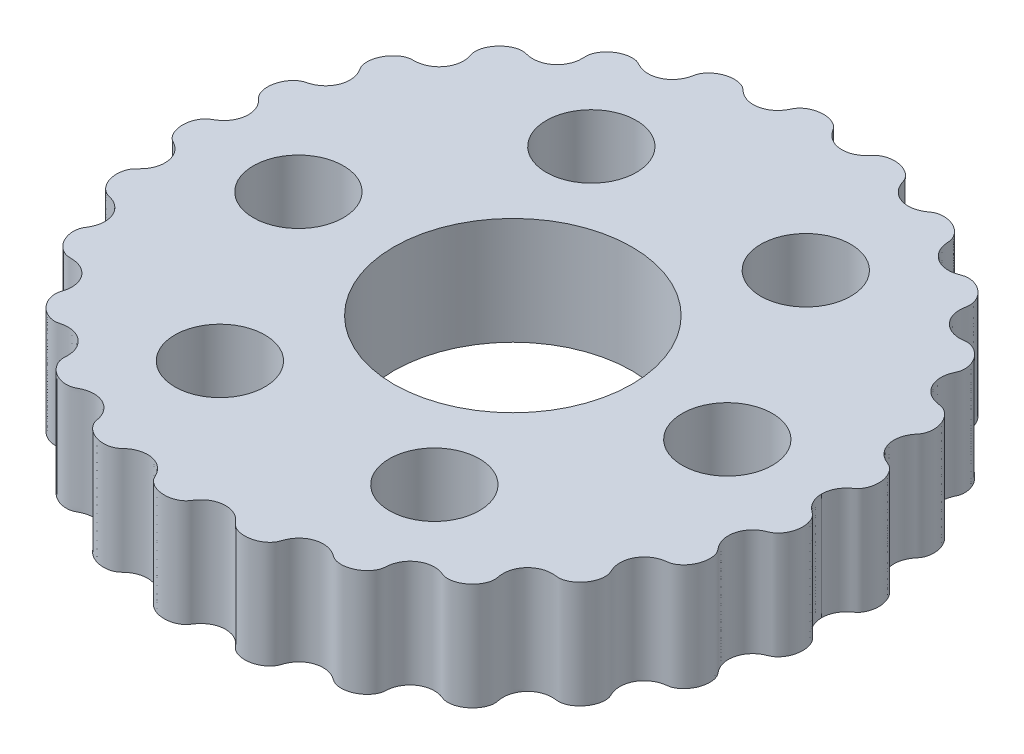
from build123d import *

# Parameters (mm, degrees)
BOSS_EXTRUDE1_DEPTH = 5
SKETCH3_R           = 2.1
CUT_EXTRUDE1_DEPTH  = 23.326267348
SKETCH5_R           = 5.55
CUT_EXTRUDE2_DEPTH  = 23.326267348


with BuildPart() as part:
    # Sketch2 → Boss-Extrude1 (new body)
    with BuildSketch(Plane(origin=(0, 0, 0), x_dir=(1, 0, 0), z_dir=(0, 1, 0))):
        with BuildLine():
            add(Edge.make_bspline(
                [(14.4, -2.48e-07), (14.4, -0.017964131), (14.400999323, -0.054156008), (14.405496279, -0.12324579), (14.417452588, -0.205733979), (14.435300772, -0.284761116), (14.45893618, -0.363830072), (14.495530695, -0.46010355), (14.553831721, -0.577672937), (14.628963244, -0.690475456), (14.720523686, -0.795156479), (14.809877886, -0.878529951), (14.885972343, -0.939710566), (14.965266253, -0.996877467), (15.039390274, -1.060755974), (15.101813025, -1.136527175), (15.154322573, -1.219306863), (15.208602362, -1.329233091), (15.256294433, -1.468797492), (15.288096968, -1.638084003), (15.294503312, -1.881018198), (15.252297927, -2.119868214), (15.163760046, -2.344380457), (15.042398399, -2.523140326), (14.942454238, -2.628650823), (14.84531186, -2.703604014), (14.757199304, -2.750371405), (14.664408479, -2.786732589), (14.573413051, -2.826966073), (14.463621811, -2.885730431), (14.30896843, -2.99023977), (14.130503739, -3.165844964), (13.97214753, -3.43499314), (13.893985611, -3.773342211), (13.916927587, -4.080339103), (13.995171076, -4.31020064), (14.08241223, -4.468542212), (14.150259365, -4.567703904), (14.210025718, -4.642870515), (14.270573552, -4.717649373), (14.320176209, -4.800200779), (14.365416677, -4.910919215), (14.399338348, -5.049561823), (14.416852099, -5.26239869), (14.384339959, -5.500937731), (14.304055891, -5.731023632), (14.177985992, -5.941781926), (14.047854196, -6.09573186), (13.910788986, -6.208565852), (13.777136588, -6.284416414), (13.654566215, -6.325933937), (13.550559771, -6.34133553), (13.446683486, -6.355615469), (13.344145731, -6.378219503), (13.218558644, -6.416412813), (13.049117811, -6.490187976), (12.850381057, -6.623877128), (12.649361495, -6.848376812), (12.506075198, -7.152262136), (12.462998251, -7.451003127), (12.489971746, -7.692058544), (12.539204468, -7.862350677), (12.58028645, -7.968000593), (12.618269622, -8.05035295), (12.654435266, -8.133644712), (12.678283575, -8.221362625), (12.692937759, -8.335981179), (12.690655472, -8.476153448), (12.654302956, -8.685493534), (12.545223608, -8.951239132), (12.373056799, -9.183722876), (12.149188229, -9.366304736), (11.953263909, -9.463318322), (11.811585985, -9.506241427), (11.686731299, -9.522483952), (11.583488414, -9.516968845), (11.481158005, -9.503432911), (11.378198356, -9.496859163), (11.27492891, -9.498212556), (11.172138152, -9.508022579), (11.00848965, -9.53818977), (10.791017774, -9.615836424), (10.543764649, -9.778692295), (10.347433573, -10.024278355), (10.24020892, -10.268607422), (10.194325427, -10.484243678), (10.185347382, -10.638429728), (10.193136342, -10.770510313), (10.209145906, -10.879533536), (10.225592928, -10.966240334), (10.235972153, -11.053921901), (10.233096033, -11.142311619), (10.215768495, -11.253426268), (10.176715504, -11.384209786), (10.088556978, -11.571773091), (9.914554743, -11.800570757), (9.643928691, -12.015790427), (9.338393465, -12.131431598), (9.092328038, -12.151919652), (8.938831082, -12.124722439), (8.874147562, -12.10491764), (8.823296452, -12.08626675), (8.760021443, -12.062210467), (8.657742174, -12.026792627), (8.51270826, -11.991319701), (8.295427931, -11.971044702), (8.023341789, -12.005783546), (7.739745144, -12.120021341), (7.477485771, -12.330308645), (7.309270878, -12.575786103), (7.227745229, -12.796401843), (7.194847234, -12.964652252), (7.183072937, -13.072922936), (7.177409691, -13.159952141), (7.163855658, -13.268191686), (7.120743744, -13.396146509), (7.043211227, -13.53573222), (6.896275027, -13.715388699), (6.667817372, -13.896296354), (6.347778495, -14.038713244), (6.019984619, -14.072733936), (5.761854657, -14.026889945), (5.598537574, -13.9438235), (5.512636, -13.880075243), (5.401772721, -13.805681202), (5.259871252, -13.730304377), (5.052430943, -13.656485505), (4.773826567, -13.622953403), (4.462558539, -13.668320481), (4.188838479, -13.799904328), (3.991154483, -13.966548105), (3.85783339, -14.133925722), (3.78259476, -14.263163115), (3.730894761, -14.379946807), (3.695922871, -14.480037823), (3.668902786, -14.560560916), (3.625075946, -14.65731075), (3.549395473, -14.764707093), (3.439982071, -14.875186556), (3.255657122, -15.006023014), (2.992826186, -15.12014402), (2.651468448, -15.175703585), (2.340640026, -15.129056213), (2.125824212, -15.033765178), (2.01095168, -14.946774732), (1.969758957, -14.909017393), (1.931738615, -14.868052651), (1.895415502, -14.825543114), (1.849862653, -14.772584168), (1.773475414, -14.691023973), (1.657606841, -14.589329712), (1.467715812, -14.468702272), (1.201269864, -14.374829544), (0.894275687, -14.35178124), (0.570472276, -14.423576672), (0.317305019, -14.563244131), (0.151543737, -14.714094099), (0.048134733, -14.841768382), (-0.011408, -14.928872831), (-0.056991615, -15.000049359), (-0.120513991, -15.084516969), (-0.216681119, -15.171117243), (-0.345492256, -15.252082149), (-0.548378411, -15.335584257), (-0.812768968, -15.385412436), (-1.083981162, -15.372591), (-1.344980225, -15.297228229), (-1.543454077, -15.192187965), (-1.665765334, -15.097631249), (-1.754670924, -15.002004579), (-1.811225099, -14.912765423), (-1.848285474, -14.836852784), (-1.894840642, -14.742230285), (-1.981133414, -14.596440624), (-2.130461975, -14.41529174), (-2.371748068, -14.237402882), (-2.694147074, -14.12430371), (-3.005808219, -14.112082243), (-3.27980323, -14.174237527), (-3.481366461, -14.271328267), (-3.607738638, -14.35811219), (-3.692851155, -14.429557516), (-3.744274314, -14.476276993), (-3.785484942, -14.513602659), (-3.839037634, -14.557815957), (-3.971848421, -14.642560884), (-4.209212537, -14.71633601), (-4.537870574, -14.723205644), (-4.870973603, -14.623309475), (-5.119165063, -14.474113271), (-5.287203238, -14.31612745), (-5.381819707, -14.188748958), (-5.441587137, -14.06862443), (-5.469754906, -13.963936343), (-5.486205657, -13.878818164), (-5.510616073, -13.773375732), (-5.562786354, -13.611201417), (-5.668640559, -13.402850243), (-5.861502161, -13.180790139), (-6.140858341, -13.003604858), (-6.432389467, -12.920478649), (-6.707047509, -12.913935003), (-6.924587844, -12.957968071), (-7.070503085, -13.011926038), (-7.171893159, -13.06122639), (-7.234172994, -13.094293424), (-7.284238774, -13.120335774), (-7.348454987, -13.149382122), (-7.450393388, -13.181304909), (-7.592860605, -13.199324175), (-7.822504876, -13.18751304), (-8.108179682, -13.101881323), (-8.360700489, -12.948081014), (-8.564055044, -12.739256852), (-8.686860825, -12.541024859), (-8.745859512, -12.39133299), (-8.771139873, -12.257944389), (-8.769724063, -12.14815779), (-8.764489294, -12.060598983), (-8.763284318, -11.951024196), (-8.773134952, -11.821211292), (-8.801859902, -11.673188778), (-8.872938117, -11.471739551), (-9.004528991, -11.249997896), (-9.220498673, -11.035105879), (-9.499738451, -10.890461106), (-9.747534163, -10.836884111), (-9.938296626, -10.832212303), (-10.067515746, -10.843723353), (-10.16983799, -10.860856705), (-10.270401867, -10.885914711), (-10.371725416, -10.908894526), (-10.499541343, -10.914402223), (-10.649899927, -10.893031168), (-10.864422553, -10.823594557), (-11.115447437, -10.67017858), (-11.318488792, -10.460804265), (-11.461427127, -10.21187442), (-11.524753371, -10.013390682), (-11.546392318, -9.877676724), (-11.548710475, -9.764592888), (-11.539340488, -9.676133867), (-11.51689895, -9.590205974), (-11.489593691, -9.505763504), (-11.460576992, -9.398790066), (-11.437116489, -9.267754038), (-11.428039041, -9.112623117), (-11.448899856, -8.891731429), (-11.525306922, -8.644377974), (-11.680560347, -8.391693336), (-11.908335499, -8.189291512), (-12.146090041, -8.066430785), (-12.351541248, -8.011177394), (-12.509041632, -7.991838642), (-12.640827037, -7.989459677), (-12.746564356, -7.988165361), (-12.874376095, -7.963827043), (-13.017764848, -7.905878909), (-13.169249477, -7.811410927), (-13.319018326, -7.674673565), (-13.471981971, -7.48051382), (-13.581459114, -7.260882561), (-13.64401371, -7.026574245), (-13.652861352, -6.812938875), (-13.63653963, -6.672849265), (-13.606445966, -6.560513177), (-13.570431599, -6.476445112), (-13.523166392, -6.398236645), (-13.47516984, -6.320636942), (-13.42152346, -6.219947813), (-13.352206861, -6.05560861), (-13.297223541, -5.817804655), (-13.306144326, -5.511230794), (-13.418271159, -5.185791445), (-13.599551019, -4.937284586), (-13.788421992, -4.782569597), (-13.950444631, -4.693121576), (-14.068010882, -4.644080471), (-14.164678518, -4.61208046), (-14.263359035, -4.586967358), (-14.36062291, -4.556202679), (-14.4720648, -4.497212289), (-14.590575081, -4.405386747), (-14.741515897, -4.240875697), (-14.885567969, -3.984038862), (-14.960547494, -3.700012411), (-14.962477183, -3.409355837), (-14.917122765, -3.199363963), (-14.864866345, -3.06554937), (-14.80476262, -2.961266815), (-14.743749732, -2.885984676), (-14.673498739, -2.81936508), (-14.60476009, -2.751453058), (-14.541077611, -2.678634146), (-14.482882478, -2.601335407), (-14.398435183, -2.468447561), (-14.309916031, -2.267780594), (-14.25723967, -1.991629089), (-14.294765542, -1.652710045), (-14.415656703, -1.372496047), (-14.564768549, -1.180601379), (-14.700945739, -1.058516228), (-14.801501711, -0.985659956), (-14.885953488, -0.933564713), (-14.973240538, -0.886145701), (-15.055953201, -0.830914272), (-15.145346025, -0.745701448), (-15.234104596, -0.62787553), (-15.302099659, -0.497915803), (-15.350570884, -0.359468333), (-15.378415718, -0.242179397), (-15.393222637, -0.147286992), (-15.398767777, -0.063517745), (-15.4, -0.021212182), (-15.4, 1.28e-07)],
                knots=[0.062565796, 0.062565796, 0.062565796, 0.062565796, 0.062565796, 0.063859973, 0.06515415, 0.066448326, 0.067742503, 0.06903668, 0.070330857, 0.07291921, 0.075992333, 0.077528894, 0.079065456, 0.080602017, 0.082138578, 0.08367514, 0.085211701, 0.086753761, 0.088295822, 0.091379943, 0.094464064, 0.097548185, 0.103528845, 0.106519174, 0.109509504, 0.111075374, 0.112641243, 0.114207112, 0.115772981, 0.117338851, 0.11890472, 0.122036458, 0.127492162, 0.132947866, 0.138255082, 0.143562297, 0.146585003, 0.148096356, 0.149607709, 0.151119061, 0.152630414, 0.154141767, 0.15565312, 0.158617995, 0.161582869, 0.167512619, 0.170668106, 0.173823593, 0.17697908, 0.180134567, 0.181785014, 0.183435461, 0.185085908, 0.186736355, 0.188386802, 0.190037249, 0.193338142, 0.198333612, 0.203329082, 0.208757311, 0.21418554, 0.217038738, 0.218465337, 0.219891935, 0.221318534, 0.222745133, 0.224171732, 0.225598331, 0.22856804, 0.23153775, 0.237477169, 0.243508984, 0.246524892, 0.2495408, 0.251163787, 0.252786774, 0.254409762, 0.256032749, 0.257655736, 0.259278723, 0.26090171, 0.262524697, 0.268116353, 0.273708009, 0.279232337, 0.2819945, 0.284756664, 0.287531357, 0.288918704, 0.290306051, 0.291693397, 0.293080744, 0.294468091, 0.295855437, 0.298751953, 0.301648468, 0.307441499, 0.313806246, 0.320170993, 0.321874543, 0.322726318, 0.323578093, 0.324429868, 0.325281643, 0.326985192, 0.330392292, 0.333799391, 0.338941908, 0.344084424, 0.349371027, 0.354657629, 0.357399899, 0.358771034, 0.360142168, 0.361513303, 0.362884438, 0.365626708, 0.368571539, 0.37151637, 0.377406032, 0.383827609, 0.390249186, 0.391929851, 0.393610516, 0.39529118, 0.396971845, 0.400333174, 0.403694503, 0.409075747, 0.41445699, 0.419832854, 0.422520785, 0.425208717, 0.427878342, 0.429213155, 0.430547968, 0.431882781, 0.433217593, 0.435887219, 0.438758038, 0.441628857, 0.447370496, 0.453780785, 0.460191075, 0.461070296, 0.461949517, 0.462828738, 0.463707959, 0.46458718, 0.465466401, 0.467224842, 0.470741726, 0.47425861, 0.479541903, 0.484825197, 0.489835983, 0.494846769, 0.497503724, 0.498832202, 0.500160679, 0.501489157, 0.502817634, 0.505474589, 0.508247059, 0.511019529, 0.516564468, 0.52227034, 0.525123276, 0.527976212, 0.530631288, 0.531958826, 0.533286364, 0.534613902, 0.53594144, 0.538596516, 0.543936045, 0.549275574, 0.554531257, 0.559786941, 0.563284399, 0.566781857, 0.568530587, 0.569404951, 0.570279316, 0.57115368, 0.572028045, 0.573776774, 0.580152949, 0.586529123, 0.592383377, 0.595310504, 0.598237631, 0.600962992, 0.602325673, 0.603688354, 0.605051034, 0.606413715, 0.609139076, 0.614392618, 0.619646159, 0.624660447, 0.629674735, 0.633223523, 0.636772312, 0.638546707, 0.639433904, 0.640321101, 0.641208298, 0.642095495, 0.64386989, 0.647025799, 0.650181709, 0.656493529, 0.662419511, 0.665382503, 0.668345494, 0.671104535, 0.672484055, 0.673863575, 0.675243096, 0.676622616, 0.679381657, 0.682041398, 0.68470114, 0.690020622, 0.695473381, 0.700926139, 0.704188253, 0.70581931, 0.707450368, 0.709081425, 0.710712482, 0.712343539, 0.713974596, 0.717095441, 0.720216286, 0.726457975, 0.732286917, 0.735201388, 0.738115858, 0.739511278, 0.740906697, 0.742302116, 0.743697535, 0.745092954, 0.746488373, 0.749279211, 0.752059022, 0.754838832, 0.760398454, 0.765423781, 0.770449108, 0.773768675, 0.777088241, 0.778748025, 0.780407808, 0.782067591, 0.783727374, 0.786901153, 0.790074931, 0.793248709, 0.796422487, 0.802397424, 0.805384893, 0.808372361, 0.809807963, 0.811243566, 0.812679168, 0.81411477, 0.815550372, 0.816985974, 0.819857178, 0.825317904, 0.830778629, 0.835989797, 0.841200965, 0.844404173, 0.846005778, 0.847607382, 0.849208986, 0.85081059, 0.852412194, 0.854013798, 0.857107086, 0.860200373, 0.866386948, 0.872352981, 0.875335998, 0.878319014, 0.879839881, 0.881360748, 0.882881615, 0.884402482, 0.885923349, 0.887444216, 0.888965083, 0.890485949, 0.895823145, 0.90116034, 0.906397405, 0.911634469, 0.914757263, 0.91631866, 0.917880057, 0.919441454, 0.921002851, 0.922564248, 0.924125645, 0.927182053, 0.930238461, 0.931766665, 0.933294869, 0.934823073, 0.936351277, 0.936351277, 0.936351277, 0.936351277, 0.936351277], degree=4))
            add(Edge.make_bspline(
                [(14.4, -2.48e-07), (14.4, 0.017963643), (14.400999324, 0.05415552), (14.405496282, 0.123245302), (14.417452594, 0.20573349), (14.435300779, 0.284760627), (14.458936189, 0.363829582), (14.495530706, 0.46010306), (14.553831735, 0.577672445), (14.628963261, 0.690474962), (14.720523706, 0.795155983), (14.809877908, 0.878529452), (14.885972367, 0.939710066), (14.965266278, 0.996876964), (15.039390301, 1.06075547), (15.101813054, 1.13652667), (15.154322603, 1.219306356), (15.208602395, 1.329232582), (15.25629447, 1.468796983), (15.288097009, 1.638083493), (15.294503359, 1.881017687), (15.25229798, 2.119867705), (15.163760104, 2.34437995), (15.042398462, 2.523139822), (14.942454304, 2.628650321), (14.845311928, 2.703603515), (14.757199373, 2.750370908), (14.664408549, 2.786732094), (14.573413122, 2.82696558), (14.463621883, 2.885729941), (14.308968504, 2.990239283), (14.130503818, 3.165844482), (13.972147616, 3.434992663), (13.893985705, 3.773341735), (13.916927688, 4.080338626), (13.995171183, 4.310200161), (14.082412341, 4.468541732), (14.150259479, 4.567703422), (14.210025833, 4.642870031), (14.270573669, 4.717648888), (14.320176329, 4.800200293), (14.3654168, 4.910918728), (14.399338473, 5.049561335), (14.41685223, 5.262398201), (14.384340096, 5.500937243), (14.304056034, 5.731023146), (14.17798614, 5.941781443), (14.047854348, 6.09573138), (13.91078914, 6.208565376), (13.777136745, 6.284415941), (13.654566372, 6.325933467), (13.550559929, 6.341335063), (13.446683645, 6.355615004), (13.34414589, 6.378219041), (13.218558803, 6.416412354), (13.049117972, 6.490187522), (12.850381222, 6.623876678), (12.649361665, 6.848376367), (12.506075376, 7.152261695), (12.462998437, 7.451002686), (12.489971937, 7.692058103), (12.539204664, 7.862350235), (12.580286648, 7.96800015), (12.618269822, 8.050352506), (12.654435469, 8.133644267), (12.67828378, 8.22136218), (12.692937966, 8.335980733), (12.690655683, 8.476153002), (12.654303173, 8.685493089), (12.545223831, 8.95123869), (12.373057028, 9.183722438), (12.149188462, 9.366304303), (11.953264144, 9.463317894), (11.811586222, 9.506241003), (11.686731537, 9.522483531), (11.583488651, 9.516968426), (11.481158241, 9.503432495), (11.378198593, 9.49685875), (11.274929146, 9.498212146), (11.172138389, 9.508022171), (11.008489887, 9.538189366), (10.791018013, 9.615836025), (10.543764892, 9.778691902), (10.347433822, 10.024277967), (10.240209176, 10.268607037), (10.194325688, 10.484243294), (10.185347647, 10.638429345), (10.19313661, 10.770509929), (10.209146177, 10.879533152), (10.225593201, 10.966239949), (10.235972428, 11.053921516), (10.23309631, 11.142311234), (10.215768775, 11.253425883), (10.176715788, 11.384209403), (10.088557266, 11.57177271), (9.914555037, 11.80057038), (9.64392899, 12.015790057), (9.338393767, 12.131431236), (9.092328341, 12.151919296), (8.938831384, 12.124722086), (8.874147863, 12.104917289), (8.823296753, 12.0862664), (8.760021743, 12.062210119), (8.657742474, 12.026792282), (8.512708559, 11.991319359), (8.295428229, 11.971044365), (8.023342088, 12.005783216), (7.739745446, 12.120021019), (7.477486078, 12.330308329), (7.309271191, 12.575785792), (7.227745548, 12.796401533), (7.194847557, 12.964651943), (7.183073263, 13.072922627), (7.177410019, 13.159951833), (7.163855988, 13.268191378), (7.120744078, 13.396146202), (7.043211564, 13.535731915), (6.896275369, 13.715388397), (6.667817718, 13.896296058), (6.347778845, 14.038712956), (6.019984969, 14.072733656), (5.761855006, 14.026889672), (5.598537921, 13.943823231), (5.512636345, 13.880074976), (5.401773065, 13.805680938), (5.259871594, 13.730304116), (5.052431284, 13.65648525), (4.773826906, 13.622953154), (4.462558879, 13.66832024), (4.188838823, 13.799904094), (3.991154831, 13.966547876), (3.857833742, 14.133925496), (3.782595116, 14.263162891), (3.730895119, 14.379946584), (3.695923232, 14.480037601), (3.668903149, 14.560560695), (3.625076311, 14.65731053), (3.549395841, 14.764706874), (3.439982442, 14.87518634), (3.255657496, 15.006022803), (2.992826562, 15.120143816), (2.651468826, 15.175703389), (2.340640403, 15.129056025), (2.125824586, 15.033764995), (2.010952052, 14.946774553), (1.969759328, 14.909017214), (1.931738985, 14.868052473), (1.895415871, 14.825542937), (1.849863021, 14.772583992), (1.77347578, 14.691023799), (1.657607204, 14.589329541), (1.467716173, 14.468702105), (1.201270222, 14.374829384), (0.894276044, 14.351781087), (0.570472635, 14.423576528), (0.317305382, 14.563243994), (0.151544104, 14.714093965), (0.048135102, 14.841768251), (-0.011407628, 14.928872701), (-0.056991241, 15.000049231), (-0.120513615, 15.084516842), (-0.216680741, 15.171117118), (-0.345491876, 15.252082028), (-0.548378029, 15.33558414), (-0.812768585, 15.385412326), (-1.08398078, 15.372590897), (-1.344979844, 15.297228132), (-1.543453699, 15.192187873), (-1.665764958, 15.097631161), (-1.75467055, 15.002004493), (-1.811224727, 14.912765339), (-1.848285105, 14.8368527), (-1.894840274, 14.742230203), (-1.981133051, 14.596440543), (-2.130461616, 14.415291664), (-2.371747714, 14.237402812), (-2.694146722, 14.124303648), (-3.005807868, 14.112082188), (-3.279802877, 14.174237479), (-3.481366106, 14.271328224), (-3.607738281, 14.35811215), (-3.692850795, 14.429557478), (-3.744273954, 14.476276956), (-3.785484581, 14.513602624), (-3.839037271, 14.557815923), (-3.971848056, 14.642560853), (-4.20921217, 14.716335985), (-4.537870208, 14.723205627), (-4.870973239, 14.623309466), (-5.119164702, 14.474113269), (-5.287202882, 14.316127452), (-5.381819354, 14.188748962), (-5.441586787, 14.068624436), (-5.469754558, 13.96393635), (-5.486205311, 13.878818171), (-5.51061573, 13.77337574), (-5.562786015, 13.611201426), (-5.668640225, 13.402850255), (-5.861501833, 13.180790155), (-6.140858017, 13.003604881), (-6.432389146, 12.92047868), (-6.707047187, 12.91393504), (-6.924587522, 12.957968114), (-7.070502761, 13.011926084), (-7.171892834, 13.061226439), (-7.234172667, 13.094293474), (-7.284238447, 13.120335826), (-7.34845466, 13.149382175), (-7.45039306, 13.181304965), (-7.592860276, 13.199324234), (-7.822504547, 13.187513105), (-8.108179356, 13.101881395), (-8.360700166, 12.948081092), (-8.564054727, 12.739256935), (-8.686860513, 12.541024946), (-8.745859203, 12.391333078), (-8.771139568, 12.257944478), (-8.76972376, 12.148157879), (-8.764488993, 12.060599072), (-8.76328402, 11.951024284), (-8.773134658, 11.821211381), (-8.801859611, 11.673188867), (-8.872937831, 11.471739642), (-9.004528711, 11.249997991), (-9.220498398, 11.035105979), (-9.49973818, 10.890461213), (-9.747533893, 10.836884224), (-9.938296357, 10.832212421), (-10.067515476, 10.843723474), (-10.16983772, 10.860856829), (-10.270401596, 10.885914837), (-10.371725144, 10.908894655), (-10.499541071, 10.914402354), (-10.649899655, 10.893031304), (-10.864422283, 10.823594698), (-11.115447172, 10.670178727), (-11.318488531, 10.460804417), (-11.461426873, 10.211874576), (-11.524753121, 10.01339084), (-11.546392072, 9.877676882), (-11.548710232, 9.764593046), (-11.539340247, 9.676134025), (-11.516898711, 9.590206131), (-11.489593455, 9.50576366), (-11.460576758, 9.398790222), (-11.437116258, 9.267754193), (-11.428038814, 9.112623272), (-11.448899634, 8.891731584), (-11.525306707, 8.644378131), (-11.680560138, 8.391693497), (-11.908335295, 8.189291679), (-12.14608984, 8.066430957), (-12.351541049, 8.011177571), (-12.509041433, 7.991838824), (-12.640826838, 7.989459862), (-12.746564157, 7.988165548), (-12.874375897, 7.963827234), (-13.017764651, 7.905879104), (-13.169249283, 7.811411125), (-13.319018135, 7.674673767), (-13.471981785, 7.480514026), (-13.581458933, 7.260882769), (-13.644013535, 7.026574455), (-13.652861182, 6.812939085), (-13.636539464, 6.672849475), (-13.606445803, 6.560513387), (-13.570431438, 6.47644532), (-13.523166232, 6.398236852), (-13.475169683, 6.320637148), (-13.421523305, 6.219948018), (-13.35220671, 6.055608813), (-13.297223396, 5.817804857), (-13.306144189, 5.511230995), (-13.41827103, 5.18579165), (-13.599550896, 4.937284795), (-13.788421873, 4.78256981), (-13.950444514, 4.693121794), (-14.068010766, 4.644080692), (-14.164678403, 4.612080683), (-14.263358921, 4.586967583), (-14.360622796, 4.556202907), (-14.472064688, 4.497212519), (-14.590574971, 4.40538698), (-14.741515792, 4.240875934), (-14.88556787, 3.984039103), (-14.960547402, 3.700012654), (-14.962477098, 3.40935608), (-14.917122685, 3.199364204), (-14.864866268, 3.065549611), (-14.804762546, 2.961267054), (-14.74374966, 2.885984913), (-14.673498669, 2.819365316), (-14.604760021, 2.751453291), (-14.541077544, 2.678634379), (-14.482882413, 2.601335638), (-14.398435122, 2.46844779), (-14.309915974, 2.267780821), (-14.25723962, 1.991629314), (-14.294765501, 1.652710271), (-14.415656668, 1.372496276), (-14.564768519, 1.180601612), (-14.700945713, 1.058516465), (-14.801501687, 0.985660195), (-14.885953465, 0.933564954), (-14.973240516, 0.886145944), (-15.05595318, 0.830914518), (-15.145346006, 0.745701695), (-15.234104581, 0.62787578), (-15.302099646, 0.497916054), (-15.350570875, 0.359468585), (-15.378415712, 0.24217965), (-15.393222633, 0.147287246), (-15.398767776, 0.063517999), (-15.4, 0.021212436), (-15.4, 1.28e-07)],
                knots=[0.062565796, 0.062565796, 0.062565796, 0.062565796, 0.062565796, 0.063859973, 0.06515415, 0.066448326, 0.067742503, 0.06903668, 0.070330857, 0.07291921, 0.075992333, 0.077528894, 0.079065456, 0.080602017, 0.082138578, 0.08367514, 0.085211701, 0.086753761, 0.088295822, 0.091379943, 0.094464064, 0.097548185, 0.103528845, 0.106519174, 0.109509504, 0.111075374, 0.112641243, 0.114207112, 0.115772981, 0.117338851, 0.11890472, 0.122036458, 0.127492162, 0.132947866, 0.138255082, 0.143562297, 0.146585003, 0.148096356, 0.149607709, 0.151119061, 0.152630414, 0.154141767, 0.15565312, 0.158617995, 0.161582869, 0.167512619, 0.170668106, 0.173823593, 0.17697908, 0.180134567, 0.181785014, 0.183435461, 0.185085908, 0.186736355, 0.188386802, 0.190037249, 0.193338142, 0.198333612, 0.203329082, 0.208757311, 0.21418554, 0.217038738, 0.218465337, 0.219891935, 0.221318534, 0.222745133, 0.224171732, 0.225598331, 0.22856804, 0.23153775, 0.237477169, 0.243508984, 0.246524892, 0.2495408, 0.251163787, 0.252786774, 0.254409762, 0.256032749, 0.257655736, 0.259278723, 0.26090171, 0.262524697, 0.268116353, 0.273708009, 0.279232337, 0.2819945, 0.284756664, 0.287531357, 0.288918704, 0.290306051, 0.291693397, 0.293080744, 0.294468091, 0.295855437, 0.298751953, 0.301648468, 0.307441499, 0.313806246, 0.320170993, 0.321874543, 0.322726318, 0.323578093, 0.324429868, 0.325281643, 0.326985192, 0.330392292, 0.333799391, 0.338941908, 0.344084424, 0.349371027, 0.354657629, 0.357399899, 0.358771034, 0.360142168, 0.361513303, 0.362884438, 0.365626708, 0.368571539, 0.37151637, 0.377406032, 0.383827609, 0.390249186, 0.391929851, 0.393610516, 0.39529118, 0.396971845, 0.400333174, 0.403694503, 0.409075747, 0.41445699, 0.419832854, 0.422520785, 0.425208717, 0.427878342, 0.429213155, 0.430547968, 0.431882781, 0.433217593, 0.435887219, 0.438758038, 0.441628857, 0.447370496, 0.453780785, 0.460191075, 0.461070296, 0.461949517, 0.462828738, 0.463707959, 0.46458718, 0.465466401, 0.467224842, 0.470741726, 0.47425861, 0.479541903, 0.484825197, 0.489835983, 0.494846769, 0.497503724, 0.498832202, 0.500160679, 0.501489157, 0.502817634, 0.505474589, 0.508247059, 0.511019529, 0.516564468, 0.52227034, 0.525123276, 0.527976212, 0.530631288, 0.531958826, 0.533286364, 0.534613902, 0.53594144, 0.538596516, 0.543936045, 0.549275574, 0.554531257, 0.559786941, 0.563284399, 0.566781857, 0.568530587, 0.569404951, 0.570279316, 0.57115368, 0.572028045, 0.573776774, 0.580152949, 0.586529123, 0.592383377, 0.595310504, 0.598237631, 0.600962992, 0.602325673, 0.603688354, 0.605051034, 0.606413715, 0.609139076, 0.614392618, 0.619646159, 0.624660447, 0.629674735, 0.633223523, 0.636772312, 0.638546707, 0.639433904, 0.640321101, 0.641208298, 0.642095495, 0.64386989, 0.647025799, 0.650181709, 0.656493529, 0.662419511, 0.665382503, 0.668345494, 0.671104535, 0.672484055, 0.673863575, 0.675243096, 0.676622616, 0.679381657, 0.682041398, 0.68470114, 0.690020622, 0.695473381, 0.700926139, 0.704188253, 0.70581931, 0.707450368, 0.709081425, 0.710712482, 0.712343539, 0.713974596, 0.717095441, 0.720216286, 0.726457975, 0.732286917, 0.735201388, 0.738115858, 0.739511278, 0.740906697, 0.742302116, 0.743697535, 0.745092954, 0.746488373, 0.749279211, 0.752059022, 0.754838832, 0.760398454, 0.765423781, 0.770449108, 0.773768675, 0.777088241, 0.778748025, 0.780407808, 0.782067591, 0.783727374, 0.786901153, 0.790074931, 0.793248709, 0.796422487, 0.802397424, 0.805384893, 0.808372361, 0.809807963, 0.811243566, 0.812679168, 0.81411477, 0.815550372, 0.816985974, 0.819857178, 0.825317904, 0.830778629, 0.835989797, 0.841200965, 0.844404173, 0.846005778, 0.847607382, 0.849208986, 0.85081059, 0.852412194, 0.854013798, 0.857107086, 0.860200373, 0.866386948, 0.872352981, 0.875335998, 0.878319014, 0.879839881, 0.881360748, 0.882881615, 0.884402482, 0.885923349, 0.887444216, 0.888965083, 0.890485949, 0.895823145, 0.90116034, 0.906397405, 0.911634469, 0.914757263, 0.91631866, 0.917880057, 0.919441454, 0.921002851, 0.922564248, 0.924125645, 0.927182053, 0.930238461, 0.931766665, 0.933294869, 0.934823073, 0.936351277, 0.936351277, 0.936351277, 0.936351277, 0.936351277], degree=4))
        make_face()
    extrude(amount=BOSS_EXTRUDE1_DEPTH)

    # Sketch3 → Cut-Extrude1 (cut, through all)
    with BuildSketch(Plane(origin=(0, 0, 0), x_dir=(1, 0, 0), z_dir=(0, 1, 0))):
        with Locations((10, 0)):
            Circle(SKETCH3_R)
        with Locations((5, -8.660254038)):
            Circle(SKETCH3_R)
        with Locations((-5, -8.660254038)):
            Circle(SKETCH3_R)
        with Locations((-10, 0)):
            Circle(SKETCH3_R)
        with Locations((-5, 8.660254038)):
            Circle(SKETCH3_R)
        with Locations((5, 8.660254038)):
            Circle(SKETCH3_R)
    extrude(amount=CUT_EXTRUDE1_DEPTH, mode=Mode.SUBTRACT)

    # Sketch5 → Cut-Extrude2 (cut, through all)
    with BuildSketch(Plane(origin=(0, 0, 0), x_dir=(1, 0, 0), z_dir=(0, 1, 0))):
        Circle(SKETCH5_R)
    extrude(amount=CUT_EXTRUDE2_DEPTH, mode=Mode.SUBTRACT)


solid = part.part
